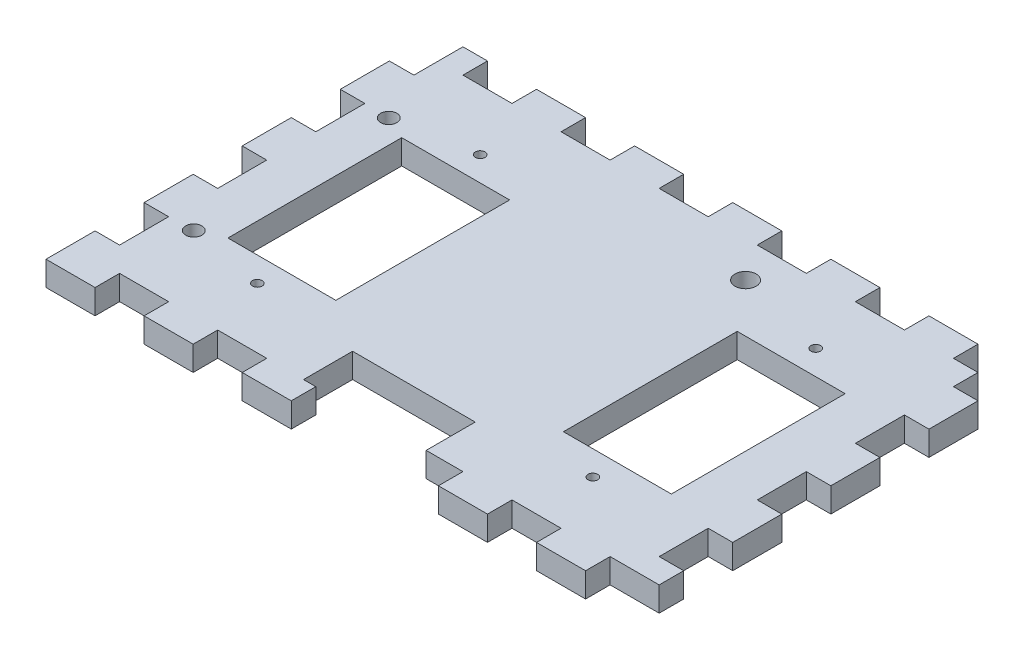
from build123d import *

# Parameters (mm, degrees)
SKETCH1_W                            = 152.4
SKETCH1_H                            = 101.6
BOSS_EXTRUDE2_DEPTH                  = 6.35
SKETCH2_W                            = 6.35
SKETCH2_H                            = 12.7
CUT_EXTRUDE2_DEPTH                   = 6.35
SKETCH2_4_W                          = 12.7
SKETCH2_4_H                          = 6.35
CUT_EXTRUDE3_DEPTH                   = 6.35
SKETCH9_W                            = 27.94
SKETCH9_H                            = 45
CUT_EXTRUDE4_DEPTH                   = 184.272045059
SKETCH12_W                           = 31.75
SKETCH12_H                           = 12.7
CUT_EXTRUDE6_DEPTH                   = 184.272045059
SKETCH17_W                           = 1.25
SKETCH17_H                           = 6.35
TAP_DRILL_FOR_M3X0_5_TAP1_AT_2_COUNT = 2
TAP_DRILL_FOR_M3X0_5_TAP1_AT_2_PITCH = 57.7
TAP_DRILL_FOR_M3X0_5_TAP1_AT_3_COUNT = 2
TAP_DRILL_FOR_M3X0_5_TAP1_AT_3_PITCH = 104.284895474
TAP_DRILL_FOR_M3X0_5_TAP1_AT_4_COUNT = 2
TAP_DRILL_FOR_M3X0_5_TAP1_AT_4_PITCH = 86.868
SKETCH30_W                           = 2.75
SKETCH30_H                           = 6.35
TAP_DRILL_FOR_M5X0_8_TAP1_D          = 4.2


with BuildPart() as part:
    # Sketch1 → Boss-Extrude2 (new body)
    with BuildSketch(Plane(origin=(0, 0, 0), x_dir=(1, 0, 0), z_dir=(0, 1, 0))):
        with Locations((76.2, 50.8)):
            Rectangle(SKETCH1_W, SKETCH1_H)
    extrude(amount=BOSS_EXTRUDE2_DEPTH)

    # Sketch2 → Cut-Extrude2 (cut)
    with BuildSketch(Plane(origin=(0, 6.35, 0), x_dir=(1, 0, 0), z_dir=(0, 1, 0))):
        with Locations((3.175, 95.25)):
            Rectangle(SKETCH2_W, SKETCH2_H)
        with Locations((3.175, 69.85)):
            Rectangle(SKETCH2_W, SKETCH2_H)
        with Locations((3.175, 44.45)):
            Rectangle(SKETCH2_W, SKETCH2_H)
        with Locations((3.175, 19.05)):
            Rectangle(SKETCH2_W, SKETCH2_H)
    cut_extrude2 = extrude(amount=-CUT_EXTRUDE2_DEPTH, mode=Mode.SUBTRACT)

    # Mirror1: Cut-Extrude2 across plane
    add(cut_extrude2.mirror(Plane.ZY.offset(-76.2)), mode=Mode.SUBTRACT)

    # Sketch2<4> → Cut-Extrude3 (cut)
    with BuildSketch(Plane(origin=(0, 6.35, 0), x_dir=(1, 0, 0), z_dir=(0, 1, 0))):
        with Locations((19.05, 98.425)):
            Rectangle(SKETCH2_4_W, SKETCH2_4_H)
        with Locations((44.45, 98.425)):
            Rectangle(SKETCH2_4_W, SKETCH2_4_H)
        with Locations((69.85, 98.425)):
            Rectangle(SKETCH2_4_W, SKETCH2_4_H)
        with Locations((95.25, 98.425)):
            Rectangle(SKETCH2_4_W, SKETCH2_4_H)
        with Locations((146.05, 98.425)):
            Rectangle(SKETCH2_4_W, SKETCH2_4_H)
        with Locations((120.65, 98.425)):
            Rectangle(SKETCH2_4_W, SKETCH2_4_H)
    cut_extrude3 = extrude(amount=-CUT_EXTRUDE3_DEPTH, mode=Mode.SUBTRACT)

    # Mirror2: Cut-Extrude3 across plane
    add(cut_extrude3.mirror(Plane(origin=(0, 0, -50.8), x_dir=(1, 0, 0), z_dir=(0, 0, -1))), mode=Mode.SUBTRACT)

    # Sketch9 → Cut-Extrude4 (cut, through all)
    with BuildSketch(Plane(origin=(0, 6.35, 0), x_dir=(1, 0, 0), z_dir=(0, 1, 0))):
        with Locations((32.766, 50.8)):
            Rectangle(SKETCH9_W, SKETCH9_H)
        with Locations((119.634, 50.8)):
            Rectangle(SKETCH9_W, SKETCH9_H)
    extrude(amount=-CUT_EXTRUDE4_DEPTH, mode=Mode.SUBTRACT)

    # Sketch12 → Cut-Extrude6 (cut, through all)
    with BuildSketch(Plane(origin=(0, 6.35, 0), x_dir=(1, 0, 0), z_dir=(0, 1, 0))):
        with Locations((76.2, 12.7)):
            Rectangle(SKETCH12_W, SKETCH12_H)
    extrude(amount=-CUT_EXTRUDE6_DEPTH, mode=Mode.SUBTRACT)


with BuildPart() as cut_extrude6_piece_1:
    # of the separate pieces the step leaves, piece 1, a body of its own (cut_extrude6_pieces)
    add(part.part.solids().sort_by_distance((0, 0, -88.9))[0])

    # Sketch17 → Tap Drill for M3x0.5 Tap1 (revolve, cut)
    with BuildSketch(Plane(origin=(32.766, 6.35, -79.65), x_dir=(0, 0, 1), z_dir=(1, 0, 0))):
        with Locations((0.625, 3.175)):
            Rectangle(SKETCH17_W, SKETCH17_H)
    tap_drill_for_m3x0_5_tap1 = revolve(axis=Axis((32.766, 12.7, -79.65), (0, -1, 0)), mode=Mode.SUBTRACT)

    # Tap Drill for M3x0.5 Tap1 at 2: Tap Drill for M3x0.5 Tap1 ×2
    with Locations(*[(0, 0, i * TAP_DRILL_FOR_M3X0_5_TAP1_AT_2_PITCH) for i in range(1, TAP_DRILL_FOR_M3X0_5_TAP1_AT_2_COUNT)]):
        add(tap_drill_for_m3x0_5_tap1, mode=Mode.SUBTRACT)

    # Tap Drill for M3x0.5 Tap1 at 3: Tap Drill for M3x0.5 Tap1 ×2
    with Locations(*[Vector(0.8329873622182414, 0, 0.5532920154716644) * (i * TAP_DRILL_FOR_M3X0_5_TAP1_AT_3_PITCH) for i in range(1, TAP_DRILL_FOR_M3X0_5_TAP1_AT_3_COUNT)]):
        add(tap_drill_for_m3x0_5_tap1, mode=Mode.SUBTRACT)

    # Tap Drill for M3x0.5 Tap1 at 4: Tap Drill for M3x0.5 Tap1 ×2
    with Locations(*[(i * TAP_DRILL_FOR_M3X0_5_TAP1_AT_4_PITCH, 0, 0) for i in range(1, TAP_DRILL_FOR_M3X0_5_TAP1_AT_4_COUNT)]):
        add(tap_drill_for_m3x0_5_tap1, mode=Mode.SUBTRACT)

    # Sketch30 → M5 Clearance Hole3 (revolve, cut)
    with BuildSketch(Plane(origin=(95.25, 0, -85.8774), x_dir=(0, 0, -1), z_dir=(1, 0, 0))):
        with Locations((1.375, 3.175)):
            Rectangle(SKETCH30_W, SKETCH30_H)
    revolve(axis=Axis((95.25, -6.35, -85.8774), (0, 1, 0)), mode=Mode.SUBTRACT)

    # Tap Drill for M5x0.8 Tap1 (through all)
    with Locations(Plane(origin=(0, 6.35, 0), x_dir=(1, 0, 0), z_dir=(0, 1, 0))):
        with Locations((12.7, 76.04), (12.7, 25.56)):
            Hole(TAP_DRILL_FOR_M5X0_8_TAP1_D / 2)


with BuildPart() as cut_extrude6_piece_2:
    # of the separate pieces the step leaves, piece 2, a body of its own (cut_extrude6_pieces)
    add(part.part.solids().sort_by_distance((88.9, 0, -6.35))[0])


solid = cut_extrude6_piece_1.part
